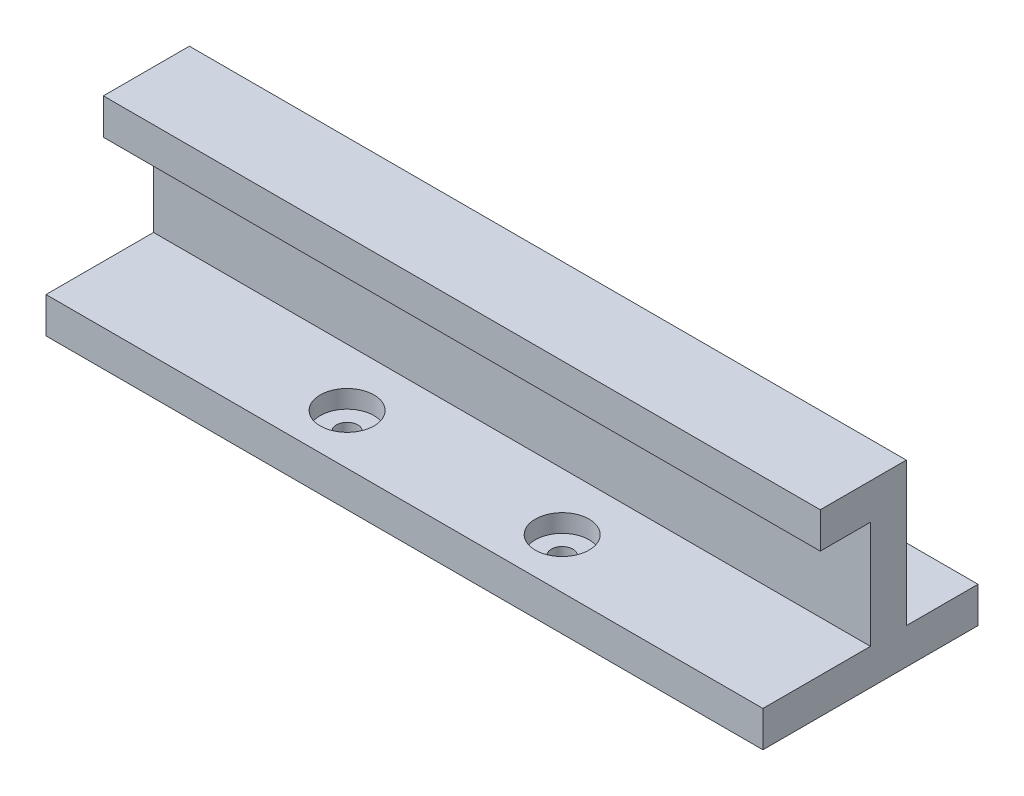
from build123d import *

# Parameters (mm, degrees)
SKETCH1_W                    = 100
SKETCH1_H                    = 20
SKETCH1_R                    = 1.5
EXTRUDE_BASE_DEPTH           = 5
SKETCH2_W                    = 100
SKETCH2_H                    = 5
EXTRUDE_VERTICAL_CLAMP_DEPTH = 20
SKETCH3_W                    = 100
SKETCH3_H                    = 5
EXTRUDE_CLAMP_ROOF_DEPTH     = 7
SKETCH5_W                    = 100
SKETCH5_H                    = 10
SKETCH5_R                    = 1.5
BOSS_EXTRUDE4_DEPTH          = 5
SKETCH4_R                    = 3.75
CUT_EXTRUDE1_DEPTH           = 2.5


with BuildPart() as part:
    # Sketch1 → Extrude-Base (new body)
    with BuildSketch(Plane(origin=(0, 0, 0), x_dir=(1, 0, 0), z_dir=(0, 1, 0))):
        with Locations((50, 10)):
            Rectangle(SKETCH1_W, SKETCH1_H)
        with Locations((35, 7)):
            Circle(SKETCH1_R, mode=Mode.SUBTRACT)
        with Locations((65, 7)):
            Circle(SKETCH1_R, mode=Mode.SUBTRACT)
    extrude(amount=EXTRUDE_BASE_DEPTH)

    # Sketch2 → Extrude-Vertical clamp (add)
    with BuildSketch(Plane(origin=(0, 5, 0), x_dir=(1, 0, 0), z_dir=(0, 1, 0))):
        with Locations((50, 17.5)):
            Rectangle(SKETCH2_W, SKETCH2_H)
    extrude(amount=EXTRUDE_VERTICAL_CLAMP_DEPTH)

    # Sketch3 → Extrude-Clamp Roof (add)
    with BuildSketch(Plane.XY.offset(-15)):
        with Locations((50, 22.5)):
            Rectangle(SKETCH3_W, SKETCH3_H)
    extrude(amount=EXTRUDE_CLAMP_ROOF_DEPTH)

    # Sketch5 → Boss-Extrude4 (add)
    with BuildSketch(Plane(origin=(0, 0, 0), x_dir=(1, 0, 0), z_dir=(0, 1, 0))):
        with Locations((50, 25)):
            Rectangle(SKETCH5_W, SKETCH5_H)
        with Locations((70, 25)):
            Circle(SKETCH5_R, mode=Mode.SUBTRACT)
        with Locations((30, 25)):
            Circle(SKETCH5_R, mode=Mode.SUBTRACT)
    extrude(amount=BOSS_EXTRUDE4_DEPTH)

    # Sketch4 → Cut-Extrude1 (cut)
    with BuildSketch(Plane(origin=(0, 5, 0), x_dir=(1, 0, 0), z_dir=(0, 1, 0))):
        with Locations((35, 7)):
            Circle(SKETCH4_R)
        with Locations((65, 7)):
            Circle(SKETCH4_R)
        with Locations((30, 25)):
            Circle(SKETCH4_R)
        with Locations((70, 25)):
            Circle(SKETCH4_R)
    extrude(amount=-CUT_EXTRUDE1_DEPTH, mode=Mode.SUBTRACT)


solid = part.part
